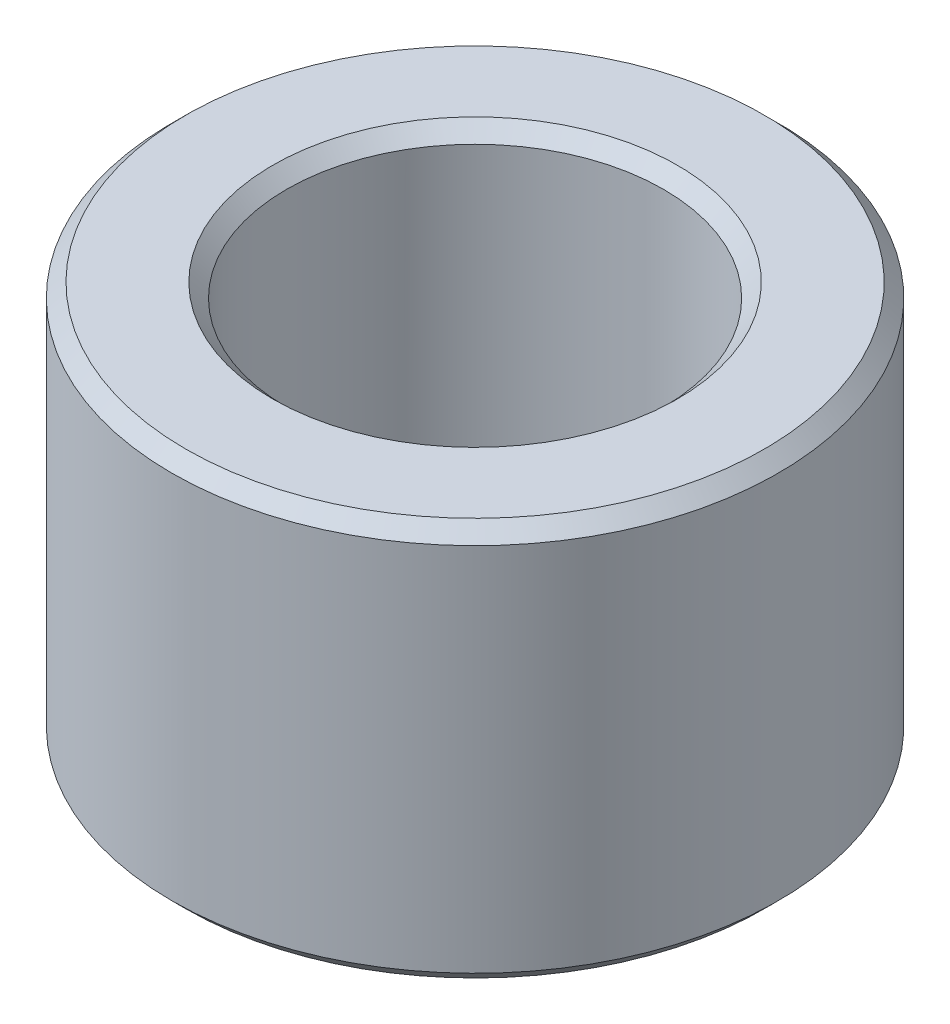
from build123d import *

# Parameters (mm, degrees)
SKETCH1_R           = 40
BOSS_EXTRUDE1_DEPTH = 52.524286365
SKETCH2_R           = 24.872500992
CUT_EXTRUDE1_DEPTH  = 78.193268218
CHAMFER1_SIZE       = 1.833903834


with BuildPart() as part:
    # Sketch1 → Boss-Extrude1 (new body)
    with BuildSketch(Plane(origin=(0, 0, 0), x_dir=(1, 0, 0), z_dir=(0, 1, 0))):
        Circle(SKETCH1_R)
    extrude(amount=BOSS_EXTRUDE1_DEPTH)

    # Sketch2 → Cut-Extrude1 (cut, through all)
    with BuildSketch(Plane(origin=(0, 0, 0), x_dir=(1, 0, 0), z_dir=(0, 1, 0))):
        Circle(SKETCH2_R)
    extrude(amount=CUT_EXTRUDE1_DEPTH, mode=Mode.SUBTRACT)

    # Chamfer1
    chamfer1_edges = [part.edges().sort_by_distance(p)[0] for p in [
        (-24.872500992, 52.524286365, 0),
        (-24.872500992, 0, 0),
        (-40, 0, 0),
        (-40, 52.524286365, 0),
    ]]
    chamfer(chamfer1_edges, length=CHAMFER1_SIZE)


solid = part.part
